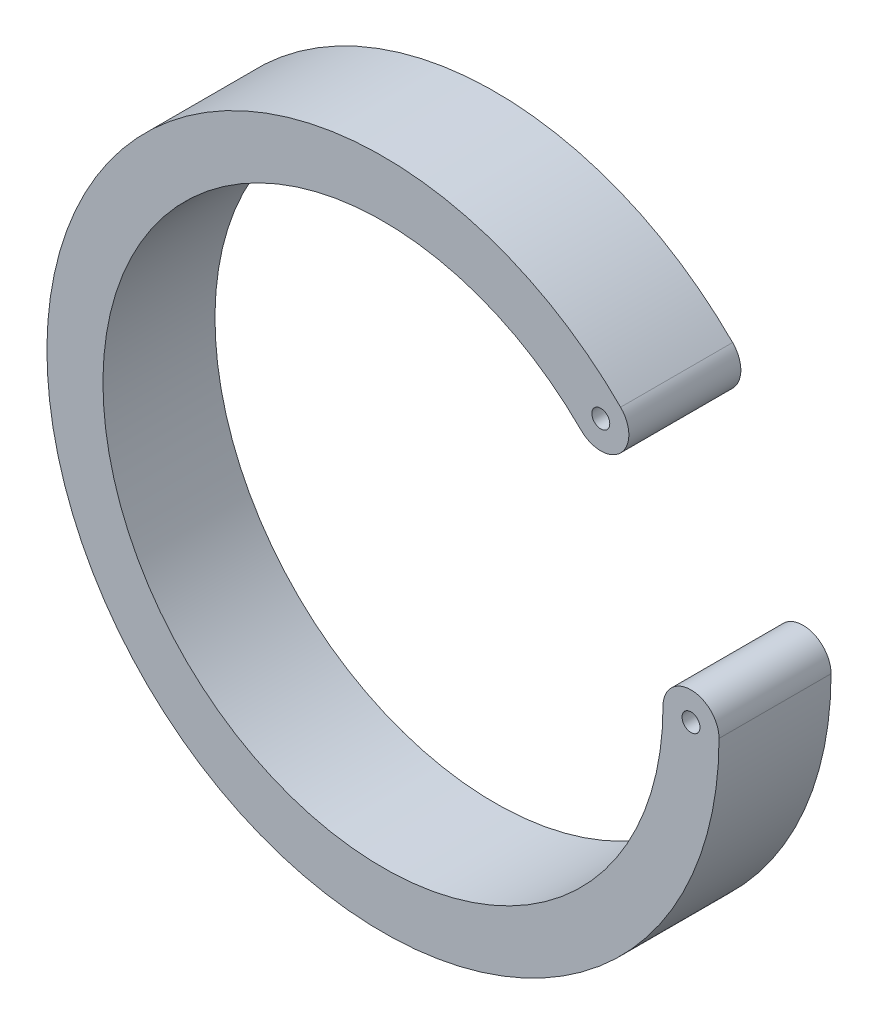
from build123d import *

# Parameters (mm, degrees)
SKETCH1_R           = 1.016
BOSS_EXTRUDE1_DEPTH = 12.7


with BuildPart() as part:
    # Sketch1 → Boss-Extrude1 (new body)
    with BuildSketch(Plane.XY):
        with BuildLine():
            ThreePointArc((31.75, 0), (-29.333175157, -12.150198978), (22.450640303, 22.450640303))
            ThreePointArc((22.450640303, 22.450640303), (26.940768363, 22.450640303), (26.940768363, 26.940768363))
            ThreePointArc((26.940768363, 26.940768363), (-35.199810189, -14.580238773), (38.1, 0))
            ThreePointArc((38.1, 0), (34.925, 3.175), (31.75, 0))
        make_face()
        with Locations((34.925, 0)):
            Circle(SKETCH1_R, mode=Mode.SUBTRACT)
        with Locations((24.695704333, 24.695704333)):
            Circle(SKETCH1_R, mode=Mode.SUBTRACT)
    extrude(amount=BOSS_EXTRUDE1_DEPTH)


solid = part.part
